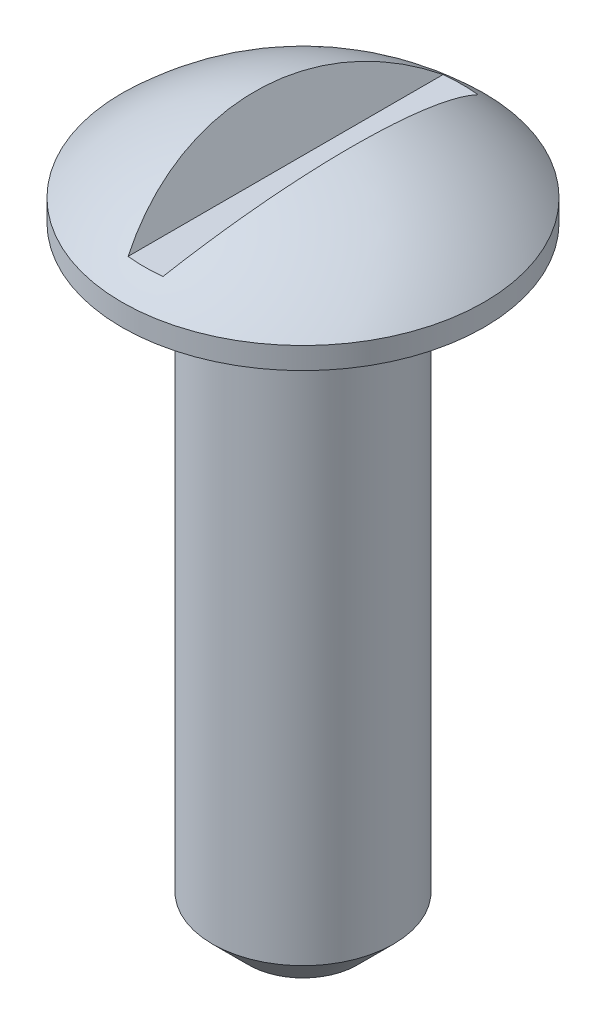
from build123d import *

# Parameters (mm, degrees)
CUT_EXTRUDE1_DEPTH      = 53.924726322676435
CUT_EXTRUDE1_DEPTH_BACK = 53.924726322676435
CHAMFER1_SIZE           = 2.54


# Read off the part's stored shape, not the designer's step: Dome1
with BuildPart() as part:
    # Sketch1 → Revolve1 (revolve)
    with BuildSketch(Plane.XY, mode=Mode.PRIVATE) as revolve1_sk:
        Polygon((0, 0), (-6.3500000000000005, 0), (-6.3500000000000005, 43.17999999999999), (-12.700000000000003, 43.17999999999999), (-12.700000000000003, 44.70399999999999), (0, 44.70399999999999), align=None)
    revolve(revolve1_sk.sketch.rotate(Axis((0, 0, 0), (0, -1, 0)), 270), axis=Axis((0, 0, 0), (0, -1, 0)))

    # Dome1 outline → Dome1 (revolve)
    with BuildSketch(Plane.XY):
        with BuildLine():
            Line((0, 44.704), (12.700000013, 44.703999987))
            ThreePointArc((12.700000013, 44.703999987), (6.839159314, 48.466898259), (0, 49.784))
            Line((0, 49.784), (0, 44.704))
        make_face()
    revolve(axis=Axis((0, 0, 0), (0, 1, 0)))

    # Sketch2 → Cut-Extrude1 (cut, two sides: drawn at the far end of the back side and taken through both)
    with BuildSketch(Plane.XY.offset(-CUT_EXTRUDE1_DEPTH_BACK)):
        Polygon((-64.2561959287237, 145.90092038345463), (-3.3800930162397096, 49.47113236614868), (-1.2214464709934951, 46.05176386515196), (1.2214464709934951, 46.05176386515196), (3.3800930162397096, 49.47113236614868), (64.2561959287237, 145.90092038345463), (64.2561959287237, 373.97638090364217), (-64.2561959287237, 373.97638090364217), align=None)
    extrude(amount=CUT_EXTRUDE1_DEPTH + CUT_EXTRUDE1_DEPTH_BACK, mode=Mode.SUBTRACT)

    # Chamfer1
    chamfer1_edges = [part.edges().sort_by_distance(p)[0] for p in [
        (-2.19e-15, 0, -6.3500000000000005),
    ]]
    chamfer(chamfer1_edges, length=CHAMFER1_SIZE)


solid = part.part
